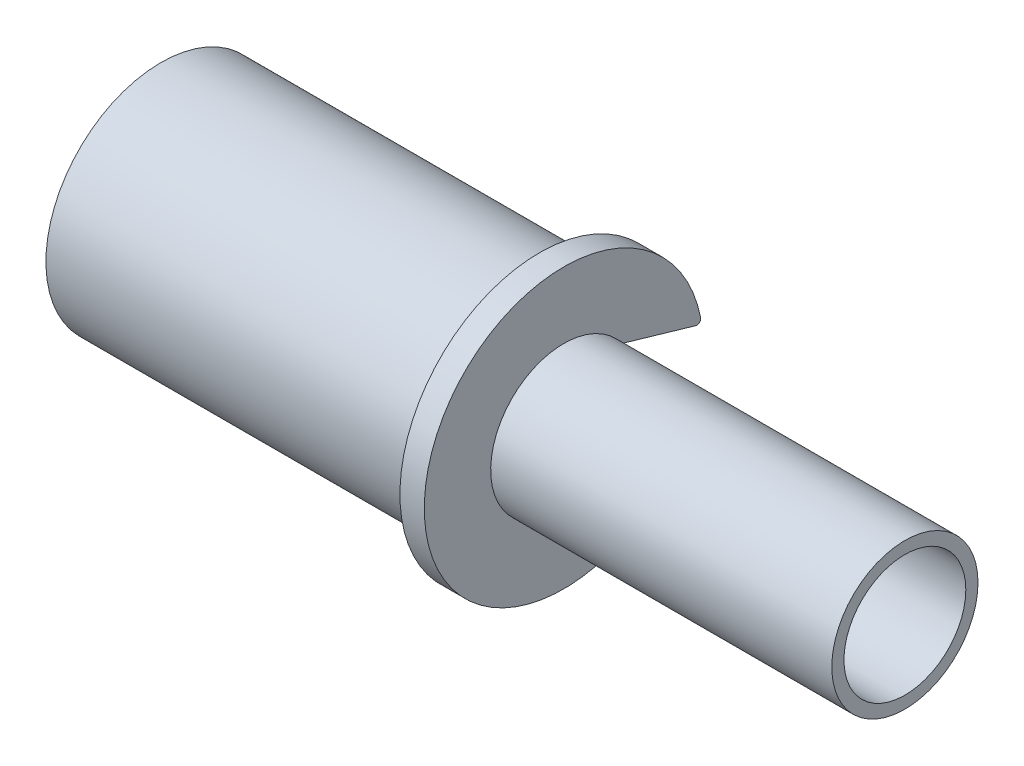
from build123d import *

# Parameters (mm, degrees)
CUT_EXTRUDE2_REACH = 55.64
FILLET1_R          = 0.254


with BuildPart() as part:
    # Sketch1 → Revolve1 (revolve)
    with BuildSketch(Plane.XY):
        Polygon((-3.615625, 3.96875), (-3.615625, 4.7625), (-25.840625, 4.7625), (-25.840625, 9.087499986), (-27.428125, 9.087499986), (-27.428125, 7.499999986), (-52.078124952, 7.499999986), (-52.078124952, 3.96875), align=None)
    revolve(axis=Axis((0, 0, 0), (-1, 0, 0)))

    # Sketch3 → Cut-Extrude2 (cut, up to next)
    with BuildSketch(Plane(origin=(0, 0, 0), x_dir=(1, 0, 0), z_dir=(0, 0.27930256399882136, 0.9602031439980211)), mode=Mode.PRIVATE) as cut_extrude2_sk1:
        with BuildLine():
            Line((-39.378124952, 1.42875), (-39.378124952, -1.42875))
            ThreePointArc((-39.378124952, -1.42875), (-38.680672975, -3.112548023), (-36.996874952, -3.81))
            Line((-36.996874952, -3.81), (-25.840625, -3.81))
            ThreePointArc((-25.840625, -3.81), (-23.59556097, -2.88006403), (-22.665625, -0.635))
            Line((-22.665625, -0.635), (-22.665625, 0.635))
            ThreePointArc((-22.665625, 0.635), (-23.59556097, 2.88006403), (-25.840625, 3.81))
            Line((-25.840625, 3.81), (-36.996874952, 3.81))
            ThreePointArc((-36.996874952, 3.81), (-38.680672975, 3.112548023), (-39.378124952, 1.42875))
        make_face()
    cut_extrude2_tool1 = extrude(cut_extrude2_sk1.sketch, amount=-CUT_EXTRUDE2_REACH, mode=Mode.PRIVATE) & part.part
    # Sketch3 → Cut-Extrude2 (cut, up to next)
    with BuildSketch(Plane(origin=(0, 0, 0), x_dir=(1, 0, 0), z_dir=(0, 0.27930256399882136, 0.9602031439980211)), mode=Mode.PRIVATE) as cut_extrude2_sk2:
        with BuildLine():
            Line((-52.078124952, 3.81), (-52.078124952, -3.81))
            Line((-52.078124952, -3.81), (-48.903124952, -3.81))
            ThreePointArc((-48.903124952, -3.81), (-47.780592937, -3.345032015), (-47.315624952, -2.2225))
            Line((-47.315624952, -2.2225), (-47.315624952, 2.2225))
            ThreePointArc((-47.315624952, 2.2225), (-47.780592937, 3.345032015), (-48.903124952, 3.81))
            Line((-48.903124952, 3.81), (-52.078124952, 3.81))
        make_face()
    cut_extrude2_tool2 = extrude(cut_extrude2_sk2.sketch, amount=-CUT_EXTRUDE2_REACH, mode=Mode.PRIVATE) & part.part
    add(cut_extrude2_tool1.solids().sort_by_distance((-31.138334, 0, 0))[0], mode=Mode.SUBTRACT)
    add(cut_extrude2_tool2.solids().sort_by_distance((-49.759137, 0, 0))[0], mode=Mode.SUBTRACT)

    # Fillet1
    fillet1_edges = [part.edges().sort_by_distance(p)[0] for p in [
        (-26.634375, 1.354059169, -8.986054738),
        (-26.634375, -5.962688788, -6.857769201),
        (-32.212499976, -5.462718258, -5.138940457),
        (-32.212499976, 1.854029699, -7.267225995),
        (-38.692149325, -4.884911767, -5.691013661),
        (-39.378124952, -2.094769226, -7.201523567),
        (-38.692149329, 1.070254562, -7.423244234),
        (-50.490624952, 1.854029699, -7.267225995),
        (-47.764947055, 1.31958979, -7.382999552),
        (-47.315624952, -2.094769226, -7.201523567),
        (-47.764947066, -5.073759551, -5.523310941),
        (-50.490624952, -5.462718258, -5.138940457),
    ]]
    fillet(fillet1_edges, radius=FILLET1_R)


solid = part.part
